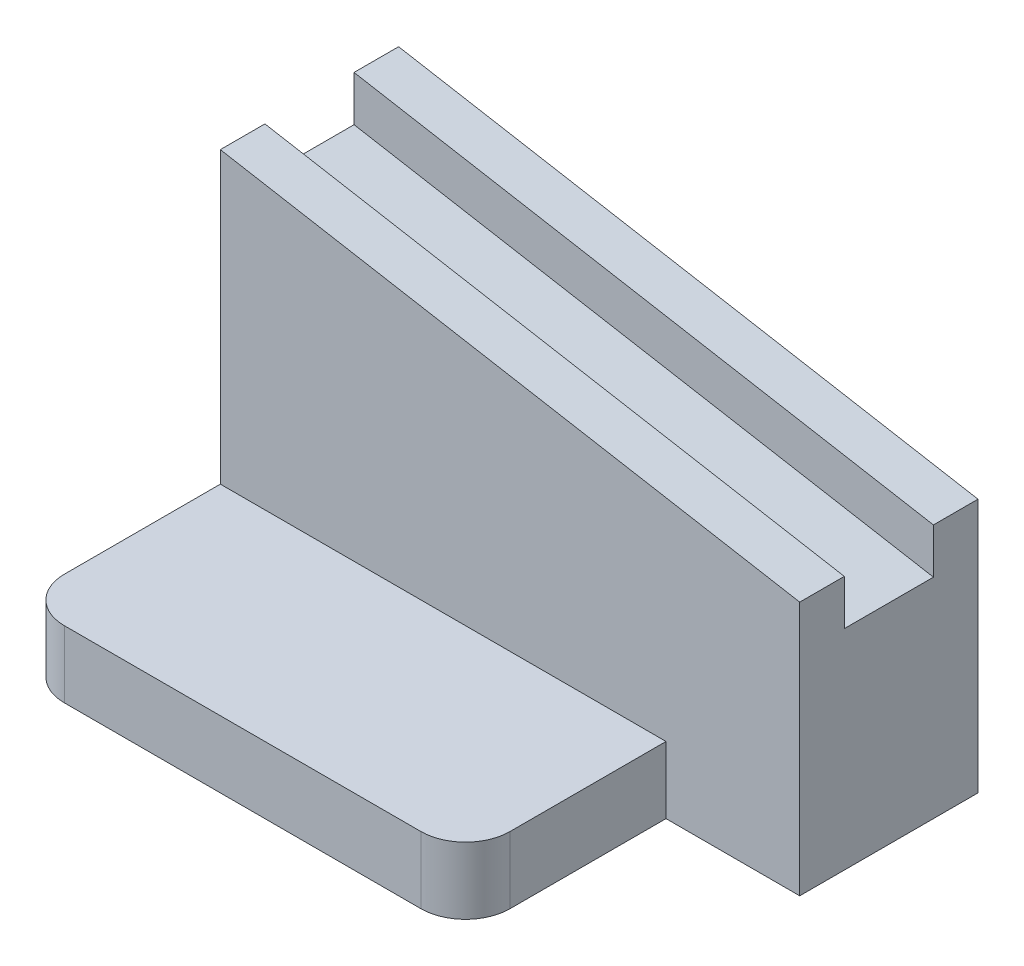
from build123d import *

# Parameters (mm, degrees)
RESSALTO_EXTRUS_O1_DEPTH = 40
ESBO_O4_W                = 171.630568717
ESBO_O4_H                = 20
CORTE_EXTRUS_O3_DEPTH    = 10
ESBO_O5_W                = 100
ESBO_O5_H                = 15
RESSALTO_EXTRUS_O2_DEPTH = 45
FILETE6_R                = 10
FILETE7_R                = 10


with BuildPart() as part:
    # Esboço1 → Ressalto-extrusão1 (new body)
    with BuildSketch(Plane.XY):
        Polygon((-53.29532416, 9.300830565), (76.70467584, 9.300830565), (76.70467584, 66.378323073), (-53.29532416, 89.300830565), align=None)
    extrude(amount=RESSALTO_EXTRUS_O1_DEPTH)

    # Esboço4 → Corte-extrusão3 (cut)
    with BuildSketch(Plane(origin=(13.664290772, 77.494043834, 0), x_dir=(0.9848077530122075, -0.17364817766693377, 0), z_dir=(0.1736481776669338, 0.9848077530122076, 0))):
        with Locations((8.431345703, -20)):
            Rectangle(ESBO_O4_W, ESBO_O4_H)
    extrude(amount=-CORTE_EXTRUS_O3_DEPTH, mode=Mode.SUBTRACT)

    # Esboço5 → Ressalto-extrusão2 (add)
    with BuildSketch(Plane.XY.offset(40)):
        with Locations((-3.29532416, 16.800830565)):
            Rectangle(ESBO_O5_W, ESBO_O5_H)
    extrude(amount=RESSALTO_EXTRUS_O2_DEPTH)

    # Filete6
    filete6_edges = [part.edges().sort_by_distance(p)[0] for p in [
        (-53.29532416, 16.800830565, 85),
    ]]
    fillet(filete6_edges, radius=FILETE6_R)

    # Filete7
    filete7_edges = [part.edges().sort_by_distance(p)[0] for p in [
        (46.70467584, 16.800830565, 85),
    ]]
    fillet(filete7_edges, radius=FILETE7_R)


solid = part.part
